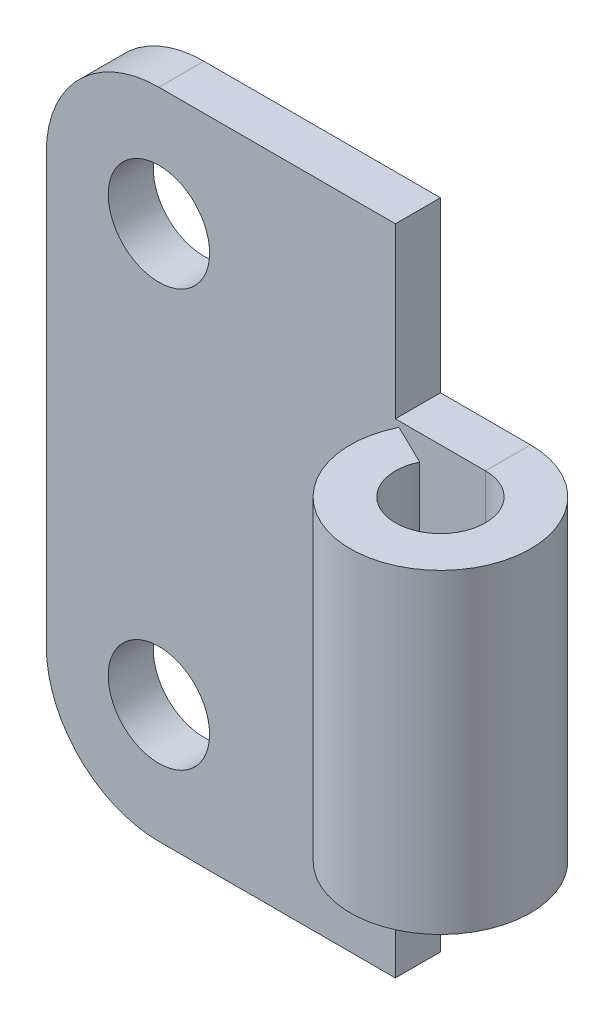
from build123d import *

# Parameters (mm, degrees)
BASE_FLANGE1_DEPTH = 4
HEM2_START         = -14
HEM2_DEPTH         = 28
SKETCH12_R         = 4.5
CUT_EXTRUDE1_DEPTH = 10
FILLET1_R          = 10


# Read off the part's stored shape, not the designer's step: Hem2
# Sheet-metal steps are written as plain solids
with BuildPart() as part:
    # Sketch1 → Base-Flange1 (new body)
    with BuildSketch(Plane.XY):
        Polygon((15.5, 14), (23.5, 14), (23.5, -14), (15.5, -14), (15.5, -29), (-15.5, -29), (-15.5, 29), (15.5, 29), align=None)
    extrude(amount=-BASE_FLANGE1_DEPTH)

    # Hem2 outline → Hem2 (add)
    with BuildSketch(Plane(origin=(0, 0, 0), x_dir=(1, 0, 0), z_dir=(0, 1, 0)).offset(HEM2_START)):
        with BuildLine():
            Line((19.904823815, -2.246515413), (16.30964763, -0.493030826))
            ThreePointArc((16.30964763, -0.493030826), (27.739354115, -10.784384769), (23.5, 4))
            Line((23.5, 4), (23.5, 0))
            ThreePointArc((23.5, 0), (25.619677058, -7.392192385), (19.904823815, -2.246515413))
        make_face()
    extrude(amount=HEM2_DEPTH)

    # Sketch12 → Cut-Extrude1 (cut)
    with BuildSketch(Plane.XY):
        with Locations((-5.5, 18.5)):
            Circle(SKETCH12_R)
        with Locations((-5.5, -18.5)):
            Circle(SKETCH12_R)
    extrude(amount=-CUT_EXTRUDE1_DEPTH, mode=Mode.SUBTRACT)

    # Fillet1
    fillet1_edges = [part.edges().sort_by_distance(p)[0] for p in [
        (-15.5, -29, -2),
        (-15.5, 29, -2),
    ]]
    fillet(fillet1_edges, radius=FILLET1_R)


solid = part.part
